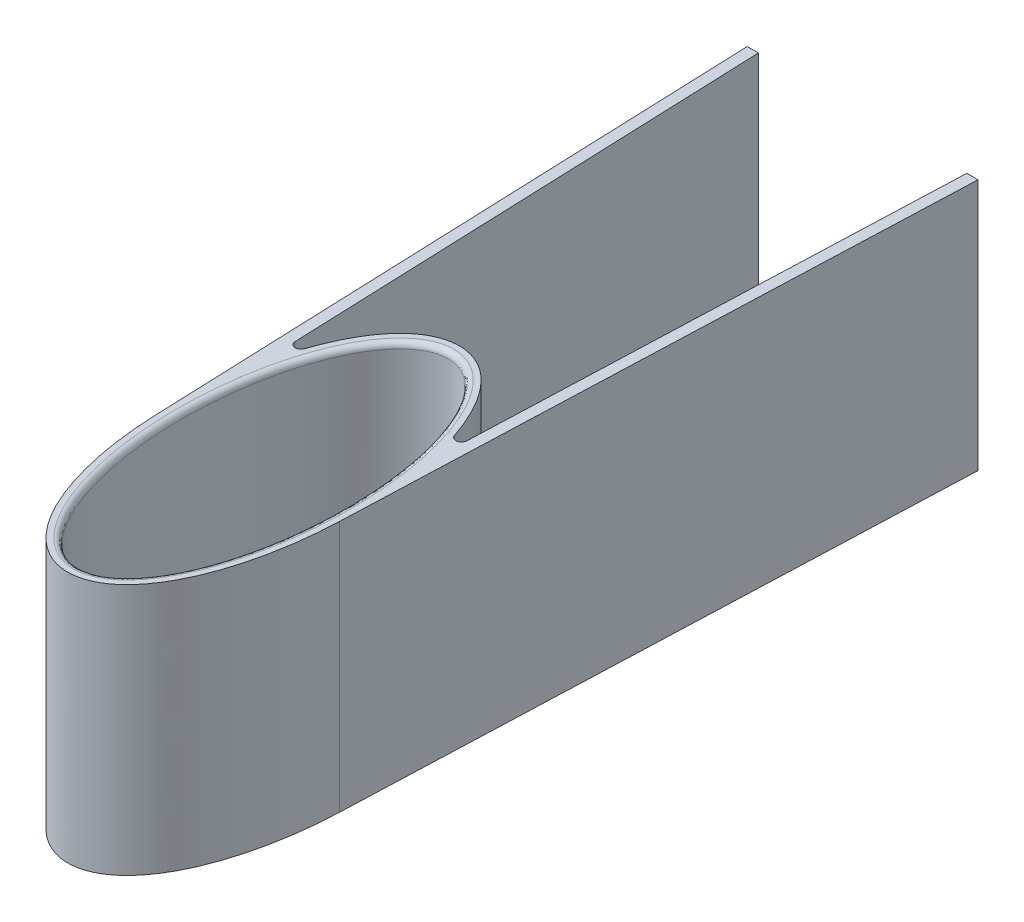
from build123d import *
from build123d.topology import SkipClean

# Parameters (mm, degrees)
BOSS_EXTRUDE1_DEPTH = 45
FILLET1_R           = 1
REVISON2_DEPTH      = 45
FILLET2_R           = 1


# Read off the part's stored shape, not the designer's step: Boss-Extrude1
with BuildPart() as part:
    # Boss-Extrude1 outline → Boss-Extrude1 (new body)
    with BuildSketch(Plane(origin=(0, 0, 0), x_dir=(1, 0, 0), z_dir=(0, 1, 0))):
        with BuildLine():
            add(Edge.make_bspline(
                [(0, -35), (1.243609867, -35), (3.7308296, -34.427119461), (6.998422981, -32.132564179), (9.800332435, -28.702559778), (12.948184519, -22.807829249), (15.725985684, -13.302805545), (16.887007158, 0), (15.725985684, 13.302805545), (12.948184519, 22.807829249), (9.800332435, 28.702559778), (6.998422981, 32.132564179), (3.7308296, 34.427119461), (0, 35.28644027), (-3.7308296, 34.427119461), (-6.998422981, 32.132564179), (-9.800332435, 28.702559778), (-12.948184519, 22.807829249), (-15.725985684, 13.302805545), (-16.887007158, 0), (-15.725985684, -13.302805545), (-12.948184519, -22.807829249), (-9.800332435, -28.702559778), (-6.998422981, -32.132564179), (-3.7308296, -34.427119461), (-1.243609867, -35), (0, -35)],
                knots=[0, 0, 0, 0, 0.196349541, 0.392699082, 0.589048623, 0.785398163, 1.178097245, 1.570796327, 1.963495408, 2.35619449, 2.552544031, 2.748893572, 2.945243113, 3.141592654, 3.337942194, 3.534291735, 3.730641276, 3.926990817, 4.319689899, 4.71238898, 5.105088062, 5.497787144, 5.694136685, 5.890486225, 6.086835766, 6.283185307, 6.283185307, 6.283185307, 6.283185307], degree=3))
        make_face()
        with BuildLine():
            add(Edge.make_bspline(
                [(0, -33), (25.11473671, -33), (12.557368355, 16.5), (0, 66), (-12.557368355, 16.5), (-25.11473671, -33), (0, -33)],
                knots=[0, 0, 0, 2.094395102, 2.094395102, 4.188790205, 4.188790205, 6.283185307, 6.283185307, 6.283185307], degree=2, weights=[1, 0.5, 1, 0.5, 1, 0.5, 1]))
        make_face(mode=Mode.SUBTRACT)
    extrude(amount=BOSS_EXTRUDE1_DEPTH)

    # Fillet1
    fillet1_edges = [part.edges().sort_by_distance(p)[0] for p in [
        (1.6984e-05, 45, -33),
    ]]
    fillet(fillet1_edges, radius=FILLET1_R)

    # Sketch2 → Revison2 (add)
    with SkipClean():  # the faces are left unmerged after this step: merging them gives an invalid solid
        with BuildSketch(Plane.XZ):
            with BuildLine():
                Line((16.444969999, 2.899691908), (20.616723541, -107.021172683))
                Line((20.616723541, -107.021172683), (18.616723541, -107.021172683))
                Line((18.616723541, -107.021172683), (15.099748921, -14.352972824))
                add(Edge.make_bspline(
                    [(15.099748921, -14.352972824), (15.19226671, -13.901710986), (16.069812152, -9.363294737), (16.584453834, -3.466609468), (16.481570237, 1.935318094), (16.444969999, 2.899691908)],
                    knots=[4.275874127, 4.275874127, 4.275874127, 4.275874127, 4.319689899, 4.71238898, 4.798084923, 4.798084923, 4.798084923, 4.798084923], degree=3))
            make_face()
            with BuildLine():
                Line((-16.444969999, 2.899691908), (-20.616723541, -107.021172683))
                Line((-20.616723541, -107.021172683), (-18.616723541, -107.021172683))
                Line((-18.616723541, -107.021172683), (-15.099748921, -14.352972824))
                add(Edge.make_bspline(
                    [(-16.444969999, 2.899691908), (-16.481570237, 1.935318094), (-16.584453834, -3.466609468), (-16.069812152, -9.363294737), (-15.19226671, -13.901710986), (-15.099748921, -14.352972824)],
                    knots=[1.485100384, 1.485100384, 1.485100384, 1.485100384, 1.570796327, 1.963495408, 2.00731118, 2.00731118, 2.00731118, 2.00731118], degree=3))
            make_face()
        extrude(amount=-REVISON2_DEPTH)
    add(part.part.scale(1), mode=Mode.REPLACE)  # the faces are merged on a copy

    # Fillet2
    fillet2_edges = [part.edges().sort_by_distance(p)[0] for p in [
        (15.099748921, 22.5, -14.352972824),
        (-15.099748921, 22.5, -14.352972824),
    ]]
    fillet(fillet2_edges, radius=FILLET2_R)


solid = part.part
